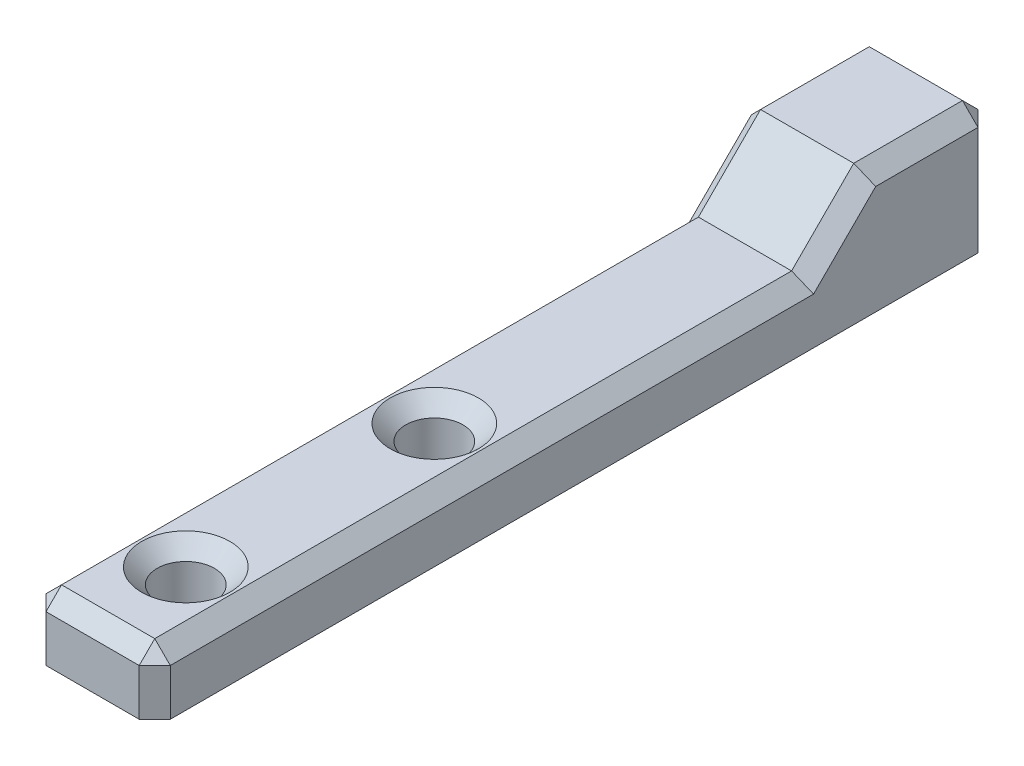
from build123d import *

# Parameters (mm, degrees)
SKETCH1_W           = 12.7
SKETCH1_H           = 85.725
SKETCH1_R           = 2.921
BOSS_EXTRUDE1_DEPTH = 12.7
SKETCH2_W           = 73.025
SKETCH2_H           = 6.35
CUT_EXTRUDE1_DEPTH  = 88.586275323
CHAMFER1_SIZE       = 6.35


# Some blends are built 0.0001 mm under size
with BuildPart() as part:
    # Sketch1 → Boss-Extrude1 (new body)
    with BuildSketch(Plane(origin=(0, 0, 0), x_dir=(1, 0, 0), z_dir=(0, 1, 0))):
        with Locations((6.35, 42.8625)):
            Rectangle(SKETCH1_W, SKETCH1_H)
        with Locations(Location((6.35, 9.525, 0), (0, 0, 270))):
            Circle(SKETCH1_R, mode=Mode.SUBTRACT)
        with Locations(Location((6.35, 34.925, 0), (0, 0, 270))):
            Circle(SKETCH1_R, mode=Mode.SUBTRACT)
    extrude(amount=BOSS_EXTRUDE1_DEPTH)

    # Sketch2 → Cut-Extrude1 (cut, through all)
    with BuildSketch(Plane(origin=(12.7, 0, 0), x_dir=(0, 0, -1), z_dir=(1, 0, 0))):
        with Locations((36.5125, 9.525)):
            Rectangle(SKETCH2_W, SKETCH2_H)
    extrude(amount=-CUT_EXTRUDE1_DEPTH, mode=Mode.SUBTRACT)

    # Chamfer1
    chamfer1_edges = [part.edges().sort_by_distance(p)[0] for p in [
        (6.35, 6.35, -73.025),
    ]]
    chamfer(chamfer1_edges, length=CHAMFER1_SIZE - 0.0001)  # a hair under: the kernel refuses the full size

    # Chamfer2
    # the kernel refuses this chamfer: 1.5875 mm, written as the material it takes off along each edge
    with BuildSketch(Plane(origin=(11.641666667, 11.641666667, -84.666666667), x_dir=(-0.7071067811865476, 0.7071067811865476, 0), z_dir=(0.5773502691896264, 0.5773502691896264, -0.5773502691896245)), Plane(origin=(1.058333333, 5.291666667, -1.058333333), x_dir=(0.7071067811865476, 0.7071067811865476, 0), z_dir=(-0.5773502691896265, 0.5773502691896265, 0.5773502691896244))) as chamfer2_piece_1:
        Polygon((-1.122532015, 0.648094161), (1.122532015, 0.648094161), (0, -1.296188322), align=None)
    extrude(amount=2.016395815, mode=Mode.SUBTRACT)
    with BuildSketch(Plane(origin=(1.058333333, 11.641666667, -84.666666667), x_dir=(0.7071067811865476, 0.7071067811865476, 0), z_dir=(-0.5773502691896264, 0.5773502691896264, -0.5773502691896245)), Plane(origin=(11.641666667, 5.291666667, -1.058333333), x_dir=(-0.7071067811865476, 0.7071067811865476, -2.571490011072639e-15), z_dir=(0.577350269189625, 0.5773502691896271, 0.5773502691896252))) as chamfer2_piece_2:
        Polygon((-1.122532015, -0.648094161), (1.122532015, -0.648094161), (0, 1.296188322), align=None)
    extrude(amount=2.016395815, mode=Mode.SUBTRACT)
    with BuildSketch(Plane(origin=(16.782546743, 12.7, -85.725), x_dir=(0, 0.027495876610586667, 0.9996219169112968), z_dir=(-1, 0, 0)), Plane(origin=(0, 12.7, -89.807546743), x_dir=(0.9996219169112968, 0.02749587661058674, 0), z_dir=(0, 0, 1)), Plane(origin=(0, -4.082546743, -85.725), x_dir=(0.9996219169112968, 0, -0.02749587661058565), z_dir=(0, 1, 0)), Plane(origin=(12.7, -4.082546743, -85.725), x_dir=(0.027495876610586667, 0, 0.9996219169112968), z_dir=(0, 1, 0))) as chamfer2_piece_3:
        with BuildLine():
            Line((1.633018697, 0), (-0.089768608, -1.630549497))
            Line((-0.089768608, -1.630549497), (-0.121506604, -1.629676503))
            ThreePointArc((-0.121506604, -1.629676503), (-0.054180148, -0.815019055), (-0.031737996, 0.000872994))
            Line((-0.031737996, 0.000872994), (0.000872994, 0.031737996))
            ThreePointArc((0.000872994, 0.031737996), (0.816765043, 0.009295844), (1.633891691, 0.031737996))
            Line((1.633891691, 0.031737996), (1.633018697, 0))
        make_face()
    extrude(amount=20.865093487, mode=Mode.SUBTRACT)
    with BuildSketch(Plane(origin=(12.7, 12.7, -68.942453257), x_dir=(0.027495876610586726, -0.9996219169112968, 0), z_dir=(0, 0, -1)), Plane(origin=(16.782546743, 6.35, 0), x_dir=(0, 0.027495876610586098, -0.9996219169112966), z_dir=(-1, 0, 0))) as chamfer2_piece_4:
        with BuildLine():
            Line((1.633018697, 0), (-0.089768608, 1.630549497))
            Line((-0.089768608, 1.630549497), (-0.121506604, 1.629676503))
            ThreePointArc((-0.121506604, 1.629676503), (-0.054180148, 0.815019055), (-0.031737996, -0.000872994))
            Line((-0.031737996, -0.000872994), (0.000872994, -0.031737996))
            ThreePointArc((0.000872994, -0.031737996), (0.816765043, -0.009295844), (1.633891691, -0.031737996))
            Line((1.633891691, -0.031737996), (1.633018697, 0))
        make_face()
    extrude(amount=20.865093487, mode=Mode.SUBTRACT)
    with BuildSketch(Plane(origin=(12.7, -4.082546743, 0), x_dir=(0.027495876610586743, 0, -0.9996219169112966), z_dir=(0, 1, 0)), Plane(origin=(0, -4.082546743, 0), x_dir=(0.9996219169112966, 0, 0.027495876610586424), z_dir=(0, 1, 0))) as chamfer2_piece_5:
        with BuildLine():
            Line((1.633018697, 0), (-0.089768608, 1.630549497))
            Line((-0.089768608, 1.630549497), (-0.121506604, 1.629676503))
            ThreePointArc((-0.121506604, 1.629676503), (-0.054180148, 0.815019055), (-0.031737996, -0.000872994))
            Line((-0.031737996, -0.000872994), (0.000872994, -0.031737996))
            ThreePointArc((0.000872994, -0.031737996), (0.816765043, -0.009295844), (1.633891691, -0.031737996))
            Line((1.633891691, -0.031737996), (1.633018697, 0))
        make_face()
    extrude(amount=14.515093487, mode=Mode.SUBTRACT)
    with BuildSketch(Plane(origin=(6.35, 6.35, -9.525), x_dir=(0, 0, 1), z_dir=(1, 0, 0))) as chamfer2_piece_6:
        with BuildLine():
            Line((4.553401281, -0.044901281), (2.876098719, 1.632401281))
            Line((2.876098719, 1.632401281), (2.844348719, 1.632401281))
            ThreePointArc((2.844348719, 1.632401281), (2.88925, 0.81620064), (2.88925, 0))
            Line((2.88925, 0), (2.921, -0.03175))
            ThreePointArc((2.921, -0.03175), (3.73720064, -0.03175), (4.553401281, -0.076651281))
            Line((4.553401281, -0.076651281), (4.553401281, -0.044901281))
        make_face()
    revolve(axis=Axis((6.35, 6.35, -9.525), (0, -1, 0)), mode=Mode.SUBTRACT)
    with BuildSketch(Plane(origin=(6.35, 6.35, -34.925), x_dir=(0, 0, 1), z_dir=(1, 0, 0))) as chamfer2_piece_7:
        with BuildLine():
            Line((4.553401281, -0.044901281), (2.876098719, 1.632401281))
            Line((2.876098719, 1.632401281), (2.844348719, 1.632401281))
            ThreePointArc((2.844348719, 1.632401281), (2.88925, 0.81620064), (2.88925, 0))
            Line((2.88925, 0), (2.921, -0.03175))
            ThreePointArc((2.921, -0.03175), (3.73720064, -0.03175), (4.553401281, -0.076651281))
            Line((4.553401281, -0.076651281), (4.553401281, -0.044901281))
        make_face()
    revolve(axis=Axis((6.35, 6.35, -34.925), (0, -1, 0)), mode=Mode.SUBTRACT)
    with BuildSketch(Plane(origin=(0, 6.35, -70.757646743), x_dir=(0.9996219169112968, 0.027495876610586195, 0), z_dir=(0, 0, 1))) as chamfer2_piece_8_section:
        with BuildLine():
            Line((1.633018697, 0), (-0.089768608, -1.630549497))
            Line((-0.089768608, -1.630549497), (-0.121506604, -1.629676503))
            ThreePointArc((-0.121506604, -1.629676503), (-0.054180148, -0.815019055), (-0.031737996, 0.000872994))
            Line((-0.031737996, 0.000872994), (0.000872994, 0.031737996))
            ThreePointArc((0.000872994, 0.031737996), (0.816765043, 0.009295844), (1.633891691, 0.031737996))
            Line((1.633891691, 0.031737996), (1.633018697, 0))
        make_face()
    chamfer2_piece_8 = extrude(amount=74.840193487, mode=Mode.PRIVATE)
    chamfer2_piece_8 = split(chamfer2_piece_8, bisect_by=Plane(origin=(0.524765539, -11.730363263, -48.594736737), z_dir=(0, 0.7071067811865479, 0.7071067811865472)), keep=Keep.TOP, mode=Mode.PRIVATE)
    add(chamfer2_piece_8, mode=Mode.SUBTRACT)
    with BuildSketch(Plane(origin=(12.7, 6.35, -70.757646743), x_dir=(0.02749587661058674, -0.9996219169112966, 0), z_dir=(0, 0, 1))) as chamfer2_piece_9_section:
        with BuildLine():
            Line((1.633018697, 0), (-0.089768608, -1.630549497))
            Line((-0.089768608, -1.630549497), (-0.121506604, -1.629676503))
            ThreePointArc((-0.121506604, -1.629676503), (-0.054180148, -0.815019055), (-0.031737996, 0.000872994))
            Line((-0.031737996, 0.000872994), (0.000872994, 0.031737996))
            ThreePointArc((0.000872994, 0.031737996), (0.816765043, 0.009295844), (1.633891691, 0.031737996))
            Line((1.633891691, 0.031737996), (1.633018697, 0))
        make_face()
    chamfer2_piece_9 = extrude(amount=74.840193487, mode=Mode.PRIVATE)
    chamfer2_piece_9 = split(chamfer2_piece_9, bisect_by=Plane(origin=(12.175234461, -11.730363263, -48.594736737), z_dir=(0, 0.7071067811865479, 0.7071067811865472)), keep=Keep.TOP, mode=Mode.PRIVATE)
    add(chamfer2_piece_9, mode=Mode.SUBTRACT)
    with BuildSketch(Plane(origin=(12.7, 3.463203513, -63.788303513), x_dir=(0.02749587661058664, -0.7068394360706738, -0.7068394360706732), z_dir=(0, 0.7071067811865472, -0.7071067811865479))) as chamfer2_piece_10_section:
        with BuildLine():
            Line((1.633018697, 0), (-0.089768608, 1.630549497))
            Line((-0.089768608, 1.630549497), (-0.121506604, 1.629676503))
            ThreePointArc((-0.121506604, 1.629676503), (-0.054180148, 0.815019055), (-0.031737996, -0.000872994))
            Line((-0.031737996, -0.000872994), (0.000872994, -0.031737996))
            ThreePointArc((0.000872994, -0.031737996), (0.816765043, -0.009295844), (1.633891691, -0.031737996))
            Line((1.633891691, -0.031737996), (1.633018697, 0))
        make_face()
    chamfer2_piece_10 = extrude(amount=17.145208187, mode=Mode.PRIVATE)
    chamfer2_piece_10 = split(chamfer2_piece_10, bisect_by=Plane(origin=(12.154882998, 6.35, -70.191724347), z_dir=(0, 1, 0)), keep=Keep.TOP, mode=Mode.PRIVATE)
    add(chamfer2_piece_10, mode=Mode.SUBTRACT)
    with BuildSketch(Plane(origin=(0, 3.463203513, -63.788303513), x_dir=(0.9996219169112968, 0.019442520806014586, 0.019442520806014572), z_dir=(0, 0.7071067811865472, -0.7071067811865479))) as chamfer2_piece_11_section:
        with BuildLine():
            Line((1.633018697, 0), (-0.089768608, 1.630549497))
            Line((-0.089768608, 1.630549497), (-0.121506604, 1.629676503))
            ThreePointArc((-0.121506604, 1.629676503), (-0.054180148, 0.815019055), (-0.031737996, -0.000872994))
            Line((-0.031737996, -0.000872994), (0.000872994, -0.031737996))
            ThreePointArc((0.000872994, -0.031737996), (0.816765043, -0.009295844), (1.633891691, -0.031737996))
            Line((1.633891691, -0.031737996), (1.633018697, 0))
        make_face()
    chamfer2_piece_11 = extrude(amount=17.145208187, mode=Mode.PRIVATE)
    chamfer2_piece_11 = split(chamfer2_piece_11, bisect_by=Plane(origin=(0.545117002, 6.35, -70.191724347), z_dir=(0, 1, 0)), keep=Keep.TOP, mode=Mode.PRIVATE)
    add(chamfer2_piece_11, mode=Mode.SUBTRACT)
    with BuildSketch(Plane(origin=(0, 3.463203513, -63.788303513), x_dir=(0.9996219169112968, 0.019442520806014586, 0.019442520806014572), z_dir=(0, 0.7071067811865472, -0.7071067811865479))) as chamfer2_piece_12a_section:
        with BuildLine():
            Line((1.633018697, 0), (-0.089768608, 1.630549497))
            Line((-0.089768608, 1.630549497), (-0.121506604, 1.629676503))
            ThreePointArc((-0.121506604, 1.629676503), (-0.054180148, 0.815019055), (-0.031737996, -0.000872994))
            Line((-0.031737996, -0.000872994), (0.000872994, -0.031737996))
            ThreePointArc((0.000872994, -0.031737996), (0.816765043, -0.009295844), (1.633891691, -0.031737996))
            Line((1.633891691, -0.031737996), (1.633018697, 0))
        make_face()
    chamfer2_piece_12a = extrude(amount=17.145208187, mode=Mode.PRIVATE)
    chamfer2_piece_12a = split(chamfer2_piece_12a, bisect_by=Plane(origin=(0.504972836, 6.35, -65.823859696), z_dir=(0, -1, 0)), keep=Keep.TOP, mode=Mode.PRIVATE)
    with BuildSketch(Plane(origin=(0, 6.35, -70.757646743), x_dir=(0.9996219169112968, 0.027495876610586195, 0), z_dir=(0, 0, 1))) as chamfer2_piece_12b_section:
        with BuildLine():
            Line((1.633018697, 0), (-0.089768608, -1.630549497))
            Line((-0.089768608, -1.630549497), (-0.121506604, -1.629676503))
            ThreePointArc((-0.121506604, -1.629676503), (-0.054180148, -0.815019055), (-0.031737996, 0.000872994))
            Line((-0.031737996, 0.000872994), (0.000872994, 0.031737996))
            ThreePointArc((0.000872994, 0.031737996), (0.816765043, 0.009295844), (1.633891691, 0.031737996))
            Line((1.633891691, 0.031737996), (1.633018697, 0))
        make_face()
    chamfer2_piece_12b = extrude(amount=74.840193487, mode=Mode.PRIVATE)
    chamfer2_piece_12b = split(chamfer2_piece_12b, bisect_by=Plane(origin=(0.504972836, 6.951917791, -67.277017791), z_dir=(0, -0.7071067811865479, -0.7071067811865472)), keep=Keep.TOP, mode=Mode.PRIVATE)
    chamfer2_piece_12 = chamfer2_piece_12a & chamfer2_piece_12b
    add(chamfer2_piece_12, mode=Mode.SUBTRACT)
    with BuildSketch(Plane(origin=(12.7, 3.463203513, -63.788303513), x_dir=(0.02749587661058664, -0.7068394360706738, -0.7068394360706732), z_dir=(0, 0.7071067811865472, -0.7071067811865479))) as chamfer2_piece_13a_section:
        with BuildLine():
            Line((1.633018697, 0), (-0.089768608, 1.630549497))
            Line((-0.089768608, 1.630549497), (-0.121506604, 1.629676503))
            ThreePointArc((-0.121506604, 1.629676503), (-0.054180148, 0.815019055), (-0.031737996, -0.000872994))
            Line((-0.031737996, -0.000872994), (0.000872994, -0.031737996))
            ThreePointArc((0.000872994, -0.031737996), (0.816765043, -0.009295844), (1.633891691, -0.031737996))
            Line((1.633891691, -0.031737996), (1.633018697, 0))
        make_face()
    chamfer2_piece_13a = extrude(amount=17.145208187, mode=Mode.PRIVATE)
    chamfer2_piece_13a = split(chamfer2_piece_13a, bisect_by=Plane(origin=(12.195027164, 6.35, -65.823859696), z_dir=(0, -1, 0)), keep=Keep.TOP, mode=Mode.PRIVATE)
    with BuildSketch(Plane(origin=(12.7, 6.35, -70.757646743), x_dir=(0.02749587661058674, -0.9996219169112966, 0), z_dir=(0, 0, 1))) as chamfer2_piece_13b_section:
        with BuildLine():
            Line((1.633018697, 0), (-0.089768608, -1.630549497))
            Line((-0.089768608, -1.630549497), (-0.121506604, -1.629676503))
            ThreePointArc((-0.121506604, -1.629676503), (-0.054180148, -0.815019055), (-0.031737996, 0.000872994))
            Line((-0.031737996, 0.000872994), (0.000872994, 0.031737996))
            ThreePointArc((0.000872994, 0.031737996), (0.816765043, 0.009295844), (1.633891691, 0.031737996))
            Line((1.633891691, 0.031737996), (1.633018697, 0))
        make_face()
    chamfer2_piece_13b = extrude(amount=74.840193487, mode=Mode.PRIVATE)
    chamfer2_piece_13b = split(chamfer2_piece_13b, bisect_by=Plane(origin=(12.195027164, 6.951917791, -67.277017791), z_dir=(0, -0.7071067811865479, -0.7071067811865472)), keep=Keep.TOP, mode=Mode.PRIVATE)
    chamfer2_piece_13 = chamfer2_piece_13a & chamfer2_piece_13b
    add(chamfer2_piece_13, mode=Mode.SUBTRACT)


solid = part.part
